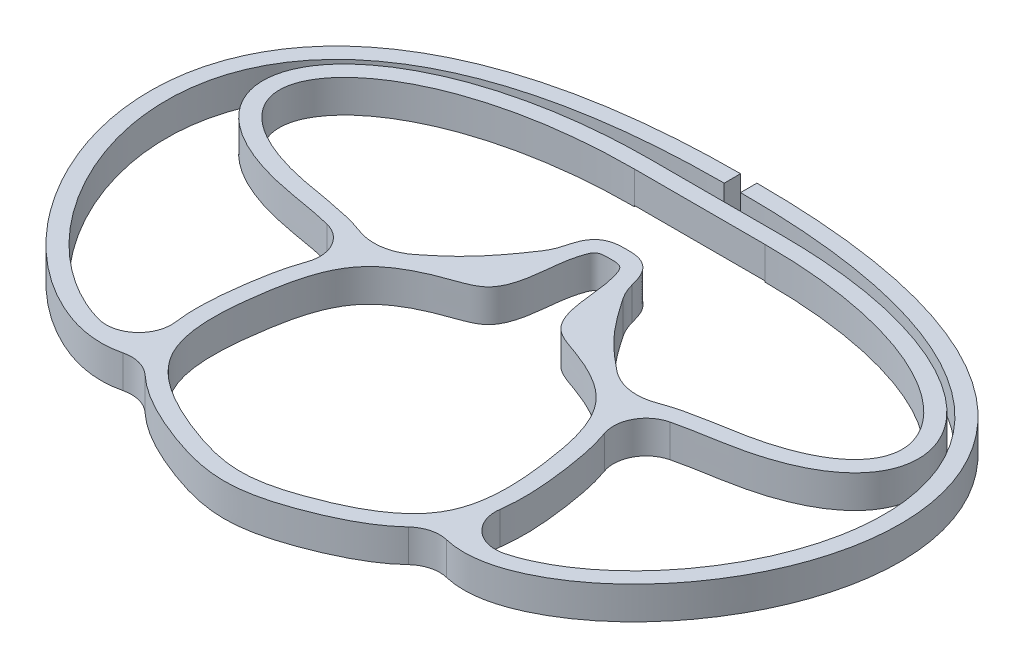
from build123d import *
from build123d.topology import SkipClean

# Parameters (mm, degrees)
BOSS_EXTRUDE1_DEPTH = 10
BOSS_EXTRUDE2_DEPTH = 10
BOSS_EXTRUDE3_REACH = 173.472
SKETCH5_W           = 5
SKETCH5_H           = 9.675639368
BOSS_EXTRUDE4_DEPTH = 10
CUT_EXTRUDE1_DEPTH  = 10
FILLET1_R           = 10
FILLET2_R           = 15
FILLET3_R           = 15


# Read off the part's stored shape, not the designer's step: Boss-Extrude1, Cut-Extrude1
with BuildPart() as part:
    # Boss-Extrude1 outline → Boss-Extrude1 (new body)
    with BuildSketch(Plane(origin=(0, 0, 0), x_dir=(1, 0, 0), z_dir=(0, 1, 0))):
        with BuildLine():
            add(Edge.make_bspline(
                [(0, 68), (-0.238192841, 68), (-0.714578522, 68.001856741), (-1.612777904, 67.984989305), (-2.655343017, 67.90630629), (-3.88355669, 67.692953245), (-5.309834598, 67.220250249), (-6.605164841, 66.456242671), (-7.552772383, 65.584445839), (-8.279350118, 64.722081264), (-8.900708421, 63.700227447), (-9.37127362, 62.643655859), (-9.688902277, 61.757004682), (-9.924621662, 61.028554697), (-10.223824219, 60.027553275), (-10.538653182, 58.81077983), (-10.845070121, 57.382000853), (-11.090339013, 55.994852174), (-11.35445641, 54.199977912), (-11.598847491, 52.061611863), (-11.850870653, 49.649911732), (-12.140926652, 47.37609929), (-12.541291471, 45.168271567), (-13.092113402, 43.130077138), (-13.666939311, 41.78278484), (-14.143364699, 41.002662707), (-14.481501461, 40.577857507), (-14.798390758, 40.27581887), (-15.44849334, 39.79487848), (-16.694634198, 39.146143506), (-18.80785084, 38.356852871), (-22.289481596, 37.160783551), (-26.671647742, 35.397705929), (-31.735557794, 32.798281901), (-35.663612414, 30.065092528), (-38.508982642, 27.450301372), (-41.104744407, 24.503063675), (-43.654977785, 20.443758172), (-46.5641494, 13.47992599), (-48.170804991, 6.094174059), (-49.247380561, -1.229258439), (-49.885101321, -6.848809574), (-50.185017834, -12.529622683), (-50.004793869, -18.197973853), (-49.162957288, -23.789910787), (-47.47318914, -29.204988889), (-44.639675129, -34.322709146), (-40.850716903, -38.638713648), (-36.452933675, -42.261825962), (-31.63021954, -45.314098475), (-26.552901856, -47.901873301), (-21.373495525, -50.099585975), (-16.252567558, -52.001266091), (-10.988811064, -53.602014991), (-5.596107317, -54.708975995), (0, -55.145512002), (5.596107317, -54.708975995), (10.988811064, -53.602014991), (16.252567558, -52.001266091), (21.373495525, -50.099585975), (26.552901856, -47.901873301), (31.63021954, -45.314098475), (36.452933675, -42.261825962), (40.850716903, -38.638713648), (44.639675129, -34.322709146), (47.47318914, -29.204988889), (49.162957288, -23.789910787), (50.004793869, -18.197973853), (50.185017834, -12.529622683), (49.885101321, -6.848809574), (49.247380561, -1.229258439), (48.170804991, 6.094174059), (46.5641494, 13.47992599), (43.654977785, 20.443758172), (41.104744407, 24.503063675), (38.508982642, 27.450301372), (35.663612414, 30.065092528), (31.735557794, 32.798281901), (26.671647742, 35.397705929), (22.289481596, 37.160783551), (18.80785084, 38.356852871), (16.694634198, 39.146143506), (15.44849334, 39.79487848), (14.798390758, 40.27581887), (14.481501461, 40.577857507), (14.143364699, 41.002662707), (13.666939311, 41.78278484), (13.092113402, 43.130077138), (12.541291471, 45.168271567), (12.140926652, 47.37609929), (11.850870653, 49.649911732), (11.598847491, 52.061611863), (11.35445641, 54.199977912), (11.090339013, 55.994852174), (10.845070121, 57.382000853), (10.538653182, 58.81077983), (10.223824219, 60.027553275), (9.924621662, 61.028554697), (9.688902277, 61.757004682), (9.37127362, 62.643655859), (8.900708421, 63.700227447), (8.279350118, 64.722081264), (7.552772383, 65.584445839), (6.605164841, 66.456242671), (5.309834598, 67.220250249), (3.88355669, 67.692953245), (2.655343017, 67.90630629), (1.612777904, 67.984989305), (0.714578522, 68.001856741), (0.238192841, 68), (0, 68)],
                knots=[0, 0, 0, 0, 0.001953125, 0.00390625, 0.005859375, 0.0078125, 0.009765625, 0.01171875, 0.012695312, 0.013671875, 0.015625, 0.017578125, 0.01953125, 0.021484375, 0.0234375, 0.02734375, 0.03125, 0.03515625, 0.0390625, 0.046875, 0.0546875, 0.0625, 0.0703125, 0.078125, 0.0859375, 0.08984375, 0.09375, 0.09765625, 0.1015625, 0.109375, 0.1171875, 0.125, 0.140625, 0.15625, 0.171875, 0.1796875, 0.1875, 0.203125, 0.21875, 0.25, 0.265625, 0.28125, 0.296875, 0.3125, 0.328125, 0.34375, 0.359375, 0.375, 0.390625, 0.40625, 0.421875, 0.4375, 0.453125, 0.46875, 0.484375, 0.5, 0.515625, 0.53125, 0.546875, 0.5625, 0.578125, 0.59375, 0.609375, 0.625, 0.640625, 0.65625, 0.671875, 0.6875, 0.703125, 0.71875, 0.734375, 0.75, 0.78125, 0.796875, 0.8125, 0.8203125, 0.828125, 0.84375, 0.859375, 0.875, 0.8828125, 0.890625, 0.8984375, 0.90234375, 0.90625, 0.91015625, 0.9140625, 0.921875, 0.9296875, 0.9375, 0.9453125, 0.953125, 0.9609375, 0.96484375, 0.96875, 0.97265625, 0.9765625, 0.978515625, 0.98046875, 0.982421875, 0.984375, 0.986328125, 0.987304688, 0.98828125, 0.990234375, 0.9921875, 0.994140625, 0.99609375, 0.998046875, 1, 1, 1, 1], degree=3))
        make_face()
        with BuildLine():
            add(Edge.make_bspline(
                [(0, 63), (-1.449277996, 63), (-3.858874195, 63.049311043), (-6.738859952, 55.675664194), (-6.381787564, 47.398306324), (-10.042156518, 35.847036856), (-22.641615801, 32.081184438), (-39.391262321, 23.88428353), (-45.052138299, -1.689202027), (-46.710048224, -32.357386891), (-21.104130521, -45.686987761), (0, -51.704322933), (21.104130521, -45.686987761), (46.710048224, -32.357386891), (45.052138299, -1.689202027), (39.391262321, 23.88428353), (22.641615801, 32.081184438), (10.042156518, 35.847036856), (6.381787564, 47.398306324), (6.738859952, 55.675664194), (3.858874195, 63.049311043), (1.449277996, 63), (0, 63)],
                knots=[0, 0, 0, 0, 0.012056684, 0.020045665, 0.067558246, 0.094840967, 0.122786523, 0.183737512, 0.260081994, 0.354207219, 0.442388761, 0.5, 0.557611239, 0.645792781, 0.739918006, 0.816262488, 0.877213477, 0.905159033, 0.932441754, 0.979954335, 0.987943316, 1, 1, 1, 1], degree=3))
        make_face(mode=Mode.SUBTRACT)
    extrude(amount=BOSS_EXTRUDE1_DEPTH)

    # Sketch4 → Boss-Extrude2 (add)
    with SkipClean():  # the faces are left unmerged after this step: merging them gives an invalid solid
        with BuildSketch(Plane(origin=(0, 0, 0), x_dir=(1, 0, 0), z_dir=(0, 1, 0))):
            with BuildLine():
                Line((39.277983001, 22.769054238), (35.980945762, 26.527983001))
                add(Edge.make_bspline(
                    [(35.980945762, 26.527983001), (36.861537311, 27.300368783), (38.746669011, 28.718002515), (42.797150261, 31.011195164), (48.285324261, 33.062315736), (55.145315531, 34.671607742), (61.941114257, 35.842281108), (68.256146671, 36.939711367), (73.808431545, 38.308577079), (78.708730533, 39.926151058), (84.345284098, 42.366639325), (89.744596156, 45.861816745), (93.70163665, 50.439446484), (95.439461655, 55.129720093), (95.273837564, 60.020705396), (93.127973537, 65.250289851), (88.843253717, 70.618542973), (82.407902629, 75.826166367), (73.876769307, 80.601217144), (63.323519173, 84.701373501), (52.908124321, 87.368972026), (43.639475181, 88.946338907), (36.231943861, 89.82478114), (29.676511118, 90.281250141), (24.229763895, 90.468136584), (21.40124799, 90.5), (20, 90.5)],
                    knots=[0, 0, 0, 0, 0.015625, 0.03125, 0.0625, 0.09375, 0.125, 0.15625, 0.1875, 0.21875, 0.25, 0.3125, 0.375, 0.4375, 0.5, 0.5625, 0.625, 0.6875, 0.75, 0.8125, 0.875, 0.90625, 0.9375, 0.96875, 0.984375, 1, 1, 1, 1], degree=3))
                Line((20, 90.5), (20, 95.5))
                add(Edge.make_bspline(
                    [(39.277983001, 22.769054238), (39.983405492, 23.387795472), (41.472912003, 24.508599434), (44.846956651, 26.4273413), (49.674902558, 28.246040373), (56.096470644, 29.760650694), (62.73373975, 30.905821337), (69.244672914, 32.034944175), (75.180494466, 33.494727565), (80.466717791, 35.238636293), (86.693098514, 37.929990387), (92.945534003, 41.938920764), (98.025049643, 47.706503612), (100.517005254, 54.297896796), (100.244069787, 61.221531573), (97.421555857, 67.935931651), (92.346585413, 74.237462235), (85.169416331, 80.02185013), (75.97379242, 85.157468329), (64.824223036, 89.48306828), (53.956996875, 92.263197598), (44.348340061, 93.89798641), (36.695459854, 94.805201376), (29.943068559, 95.275191829), (24.342511435, 95.467296881), (21.438991317, 95.5), (20, 95.5)],
                    knots=[0, 0, 0, 0, 0.015625, 0.03125, 0.0625, 0.09375, 0.125, 0.15625, 0.1875, 0.21875, 0.25, 0.3125, 0.375, 0.4375, 0.5, 0.5625, 0.625, 0.6875, 0.75, 0.8125, 0.875, 0.90625, 0.9375, 0.96875, 0.984375, 1, 1, 1, 1], degree=3))
            make_face()
            with BuildLine():
                Line((42.096342426, -33.432740086), (44.682740086, -29.153657574))
                add(Edge.make_bspline(
                    [(44.682740086, -29.153657574), (45.08188169, -29.39490997), (45.904858172, -29.858575174), (47.52555344, -30.641493568), (49.562977181, -31.395443347), (52.017046315, -31.962265967), (55.320016477, -32.305985454), (59.523728018, -32.013011081), (64.679082923, -30.64212577), (69.88781924, -28.402696478), (76.737042845, -24.507346348), (84.939869816, -18.058479869), (93.754244909, -8.253771624), (103.541747728, 6.929404427), (109.521201812, 24.286992603), (110.120598711, 41.838575461), (107.529242797, 54.641385244), (101.525817443, 66.690609007), (91.658408248, 77.63436606), (79.77685087, 85.487646165), (67.82543616, 90.759337976), (57.582461406, 94.141279674), (46.005454648, 96.885725071), (35.203336804, 98.587256025), (25.842415638, 99.565202123), (18.458455235, 100.099138062), (11.988302155, 100.371282141), (6.639000535, 100.481428015), (3.872002289, 100.5), (2.5, 100.5)],
                    knots=[0, 0, 0, 0, 0.0078125, 0.015625, 0.03125, 0.046875, 0.0625, 0.09375, 0.125, 0.15625, 0.1875, 0.25, 0.3125, 0.375, 0.5, 0.5625, 0.625, 0.6875, 0.75, 0.8125, 0.84375, 0.875, 0.90625, 0.9375, 0.953125, 0.96875, 0.984375, 0.9921875, 1, 1, 1, 1], degree=3))
                Line((2.5, 100.5), (2.5, 105.5))
                add(Edge.make_bspline(
                    [(42.096342426, -33.432740086), (42.58342388, -33.727145798), (43.584158703, -34.291005639), (45.583663477, -35.257541637), (48.122338287, -36.197687402), (51.194683252, -36.907281922), (55.301501297, -37.333075269), (60.399349794, -36.966888187), (66.366319672, -35.366570693), (72.135705065, -32.880082024), (79.593067498, -28.63571279), (88.394364742, -21.706362601), (97.749741791, -11.294250799), (105.517183725, 0.756658036), (111.292732359, 13.992835961), (114.653650364, 27.966545022), (115.152412458, 42.223395392), (112.317856654, 56.276539054), (105.691382302, 69.57198306), (94.897203923, 81.515436798), (82.17750106, 89.898356847), (69.60386742, 95.440602533), (58.927587702, 98.963316503), (46.956065063, 101.799444082), (35.857991508, 103.546417134), (26.279113303, 104.546947452), (18.740656001, 105.09191975), (12.149078547, 105.369086909), (6.706401539, 105.481129809), (3.894629285, 105.5), (2.5, 105.5)],
                    knots=[0, 0, 0, 0, 0.0078125, 0.015625, 0.03125, 0.046875, 0.0625, 0.09375, 0.125, 0.15625, 0.1875, 0.25, 0.3125, 0.375, 0.4375, 0.5, 0.5625, 0.625, 0.6875, 0.75, 0.8125, 0.84375, 0.875, 0.90625, 0.9375, 0.953125, 0.96875, 0.984375, 0.9921875, 1, 1, 1, 1], degree=3))
            make_face()
        boss_extrude2 = extrude(amount=BOSS_EXTRUDE2_DEPTH)
    add(part.part.scale(1), mode=Mode.REPLACE)  # the faces are merged on a copy

    # Mirror1: Boss-Extrude2 across plane
    add(boss_extrude2.mirror(Plane(origin=(0, 0, 0), x_dir=(0, 0, 1), z_dir=(1, 0, 0))))

    # Sketch5 → Boss-Extrude3 (add, up to next)
    with BuildSketch(Plane(origin=(-20, 0, 0), x_dir=(0, 0, -1), z_dir=(1, 0, 0)), mode=Mode.PRIVATE) as boss_extrude3_sk1:
        with Locations((93, 5.162180316)):
            Rectangle(SKETCH5_W, SKETCH5_H)
    boss_extrude3_tool1 = extrude(boss_extrude3_sk1.sketch, amount=BOSS_EXTRUDE3_REACH, mode=Mode.PRIVATE) - part.part
    add(boss_extrude3_tool1.solids().sort_by_distance((-20, 5.16218, -93))[0])

    # Sketch6 → Boss-Extrude4 (add)
    with BuildSketch(Plane(origin=(0, 0, 0), x_dir=(1, 0, 0), z_dir=(0, 1, 0))):
        with BuildLine():
            add(Edge.make_bspline(
                [(-41.157619963, 24.22418314), (-40.140970796, 28.388225203), (-16.561022796, 41.075457211), (0, 83.298155699), (16.561022796, 41.075457211), (72.396249111, 11.033216641), (-44.37818904, 11.033216641), (-41.157619963, 24.22418314)],
                knots=[0, 0, 0, 0, 0.128214101, 0.29691993, 0.465625759, 0.59383986, 1, 1, 1, 1], degree=3))
        make_face()
    extrude(amount=BOSS_EXTRUDE4_DEPTH)

    # Cut-Extrude1 outline → Cut-Extrude1 (cut)
    with BuildSketch(Plane(origin=(0, 0, 0), x_dir=(1, 0, 0), z_dir=(0, 1, 0))):
        with BuildLine():
            add(Edge.make_bspline(
                [(38.136867299, 19.73868549), (37.430027819, 20.895360226), (32.993084241, 27.015408216), (22.641615801, 32.081184438), (10.042156518, 35.847036856), (6.381787564, 47.398306324), (6.738859952, 55.675664194), (3.858874195, 63.049311043), (0, 62.970341334), (-3.858874195, 63.049311043), (-6.738859952, 55.675664194), (-6.381787564, 47.398306324), (-10.042156518, 35.847036856), (-22.641615801, 32.081184438), (-32.993084241, 27.015408216), (-37.430027819, 20.895360226), (-38.136867299, 19.73868549)],
                knots=[0.803038234, 0.803038234, 0.803038234, 0.803038234, 0.816262488, 0.877213477, 0.905159033, 0.932441754, 0.979954335, 0.987943316, 1, 1.012056684, 1.020045665, 1.067558246, 1.094840967, 1.122786523, 1.183737512, 1.196961766, 1.196961766, 1.196961766, 1.196961766], degree=3))
            add(Edge.make_bspline(
                [(-38.136867299, 19.73868549), (-25.102339704, 12.528382524), (25.102339704, 12.528382524), (38.136867299, 19.73868549)],
                knots=[0.052936841, 0.052936841, 0.052936841, 0.052936841, 0.353223299, 0.353223299, 0.353223299, 0.353223299], degree=3))
        make_face()
    extrude(amount=CUT_EXTRUDE1_DEPTH, mode=Mode.SUBTRACT)

    # Fillet1
    fillet1_edges = [part.edges().sort_by_distance(p)[0] for p in [
        (-41.157619963, 5, -24.22418314),
        (-46.773860877, 5, 30.272379947),
        (-44.198810228, 5, 34.582685812),
        (44.198810228, 5, 34.582685812),
        (46.773860877, 5, 30.272379947),
        (41.157619963, 5, -24.22418314),
    ]]
    fillet(fillet1_edges, radius=FILLET1_R)

    # Fillet2
    fillet2_edges = [part.edges().sort_by_distance(p)[0] for p in [
        (-38.196428291, 5, -28.255337792),
        (38.196428291, 5, -28.255337792),
    ]]
    fillet(fillet2_edges, radius=FILLET2_R)

    # Fillet3
    fillet3_edges = [part.edges().sort_by_distance(p)[0] for p in [
        (10.917567509, 5, -56.954217155),
        (-10.917567509, 5, -56.954217155),
    ]]
    fillet(fillet3_edges, radius=FILLET3_R)


solid = part.part
